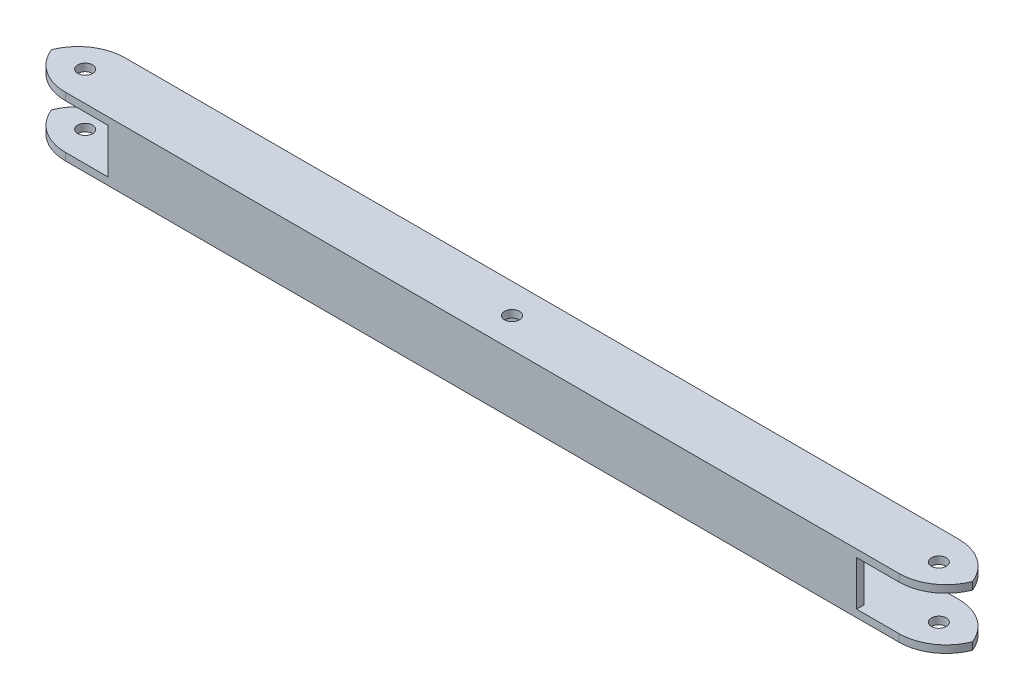
from build123d import *

# Parameters (mm, degrees)
SKETCH1_W           = 395.5
SKETCH1_H           = 25.4
SKETCH1_R           = 3.175
BOSS_EXTRUDE1_DEPTH = 25.4
CUT_EXTRUDE1_REACH  = 399.128
SKETCH2_W           = 19.05
SKETCH2_H           = 19.05
SKETCH4_W           = 25.4
SKETCH4_H           = 19.05
CUT_EXTRUDE2_DEPTH  = 38.1
FILLET1_R           = 20


with BuildPart() as part:
    # Sketch1 → Boss-Extrude1 (new body)
    with BuildSketch(Plane(origin=(0, 0, 0), x_dir=(1, 0, 0), z_dir=(0, 1, 0))):
        with Locations((197.75, -12.7)):
            Rectangle(SKETCH1_W, SKETCH1_H)
        with Locations(Location((197.75, -12.7, 0), (0, 0, 270))):
            Circle(SKETCH1_R, mode=Mode.SUBTRACT)
        with Locations(Location((15.76, -12.7, 0), (0, 0, 270))):
            Circle(SKETCH1_R, mode=Mode.SUBTRACT)
        with Locations(Location((379.74, -12.7, 0), (0, 0, 90))):
            Circle(SKETCH1_R, mode=Mode.SUBTRACT)
    extrude(amount=BOSS_EXTRUDE1_DEPTH)

    # Cut-Extrude1: up to this face of the body (flat: up to its plane)
    cut_extrude1_end = Plane(part.part.faces().sort_by_distance((395.5, 12.7, 12.7))[0])
    # Sketch2 → Cut-Extrude1 (cut, up to the picked face)
    with BuildSketch(Plane.ZY, mode=Mode.PRIVATE) as cut_extrude1_sk1:
        with Locations((12.7, 12.7)):
            Rectangle(SKETCH2_W, SKETCH2_H)
    cut_extrude1_tool1 = split(extrude(cut_extrude1_sk1.sketch, amount=-CUT_EXTRUDE1_REACH, mode=Mode.PRIVATE), bisect_by=cut_extrude1_end, keep=Keep.BOTH, mode=Mode.PRIVATE)
    add(cut_extrude1_tool1.solids().sort_by(Axis((0, 12.7, 12.7), (1, 0, 0)))[0], mode=Mode.SUBTRACT)

    # Sketch4 → Cut-Extrude2 (cut)
    with BuildSketch(Plane.ZY):
        with Locations((12.7, 12.7)):
            Rectangle(SKETCH4_W, SKETCH4_H)
    cut_extrude2 = extrude(amount=-CUT_EXTRUDE2_DEPTH, mode=Mode.SUBTRACT)

    # Mirror1: Cut-Extrude2 across plane
    add(cut_extrude2.mirror(Plane.ZY.offset(-197.75)), mode=Mode.SUBTRACT)

    # Fillet1
    # the kernel refuses this fillet: 20 mm, written as the material it takes off along each edge
    with BuildSketch(Plane(origin=(395.5, -50, 0), x_dir=(-1, 0, 0), z_dir=(0, 1, 0)), Plane(origin=(395.5, -27.775, 0), x_dir=(-1, 0, 0), z_dir=(0, 1, 0)), Plane(origin=(0, -27.775, 25.4), x_dir=(1, 0, 0), z_dir=(0, 1, 0))) as fillet1_piece_1:
        with BuildLine():
            CenterArc((FILLET1_R, FILLET1_R), FILLET1_R, 180, 90)
            Line((0, FILLET1_R), (0, 0))
            Line((0, 0), (FILLET1_R, 0))
        make_face()
    extrude(amount=103.175, mode=Mode.SUBTRACT)
    with BuildSketch(Plane(origin=(395.5, -50, 25.4), x_dir=(-1, 0, 0), z_dir=(0, 1, 0)), Plane(origin=(395.5, -27.775, 25.4), x_dir=(-1, 0, 0), z_dir=(0, 1, 0)), Plane(origin=(0, -50, 25.4), x_dir=(0, 0, -1), z_dir=(0, 1, 0)), Plane(origin=(0, -50, 0), x_dir=(1, 0, 0), z_dir=(0, 1, 0)), Plane(origin=(0, -27.775, 0), x_dir=(1, 0, 0), z_dir=(0, 1, 0))) as fillet1_piece_2:
        with BuildLine():
            CenterArc((FILLET1_R, -FILLET1_R), FILLET1_R, 90, 90)
            Line((0, -FILLET1_R), (0, 0))
            Line((0, 0), (FILLET1_R, 0))
        make_face()
    extrude(amount=103.175, mode=Mode.SUBTRACT)


solid = part.part
